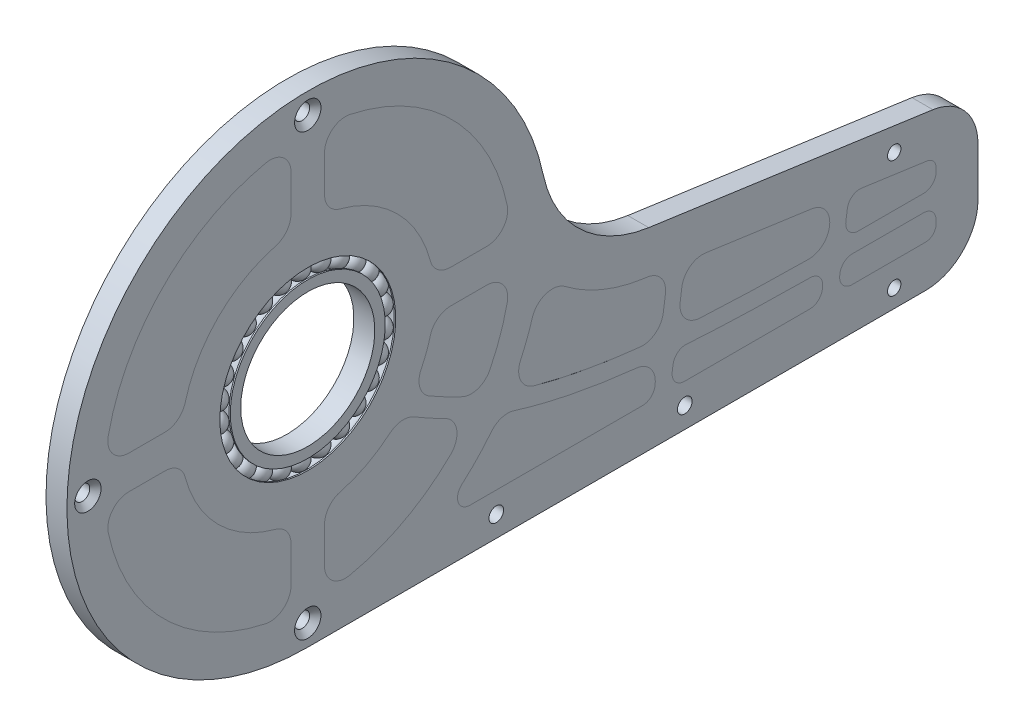
from build123d import *
from OCP.BRepFilletAPI import BRepFilletAPI_MakeFillet

# Parameters (mm, degrees)
SKETCH1_R                                    = 23.5
SKETCH1_R_2                                  = 1.75
BOSS_EXTRUDE1_DEPTH                          = 5
CUT_EXTRUDE1_DEPTH                           = 171.091886932
SKETCH11_R                                   = 1.6
CUT_EXTRUDE2_DEPTH                           = 171.091887063
FILLET1_R1                                   = 5
FILLET1_R2                                   = 3
BOSS_EXTRUDE2_DEPTH                          = 5
CIRPATTERN1_COUNT                            = 26
SKETCH7_R                                    = 1.75
BOSS_EXTRUDE3_DEPTH                          = 5
CSK_FOR_M3_COUNTERSUNK_FLAT_HEAD_SCR_2_COUNT = 2
CSK_FOR_M3_COUNTERSUNK_FLAT_HEAD_SCR_2_PITCH = 74.246212025
CSK_FOR_M3_COUNTERSUNK_FLAT_HEAD_SCR_3_COUNT = 2
CSK_FOR_M3_COUNTERSUNK_FLAT_HEAD_SCR_3_PITCH = 105


# Read off the part's stored shape, not the designer's step: Boss-Extrude2
with BuildPart() as part:
    # Sketch1 → Boss-Extrude1 (new body)
    with BuildSketch(Plane(origin=(0, 0, 0), x_dir=(0, 0, -1), z_dir=(1, 0, 0))):
        with BuildLine():
            Line((0, -57.5), (147.5, -57.5))
            ThreePointArc((147.5, -57.5), (156.338834765, -53.838834765), (160, -45))
            Line((160, -45), (160, -33.365178619))
            ThreePointArc((160, -33.365178619), (156.934208165, -25.164830072), (149.240685392, -20.986971383))
            Line((149.240685392, -20.986971383), (81.395536862, -11.446247371))
            ThreePointArc((81.395536862, -11.446247371), (65.121194516, -3.68658445), (56.233805186, 12.000381425))
            ThreePointArc((56.233805186, 12.000381425), (-44.700514158, 36.16785913), (0, -57.5))
        make_face()
        Circle(SKETCH1_R, mode=Mode.SUBTRACT)
        with Locations((0, 52.5)):
            Circle(SKETCH1_R_2, mode=Mode.SUBTRACT)
        with Locations((-52.5, 0)):
            Circle(SKETCH1_R_2, mode=Mode.SUBTRACT)
        with Locations((0, -52.5)):
            Circle(SKETCH1_R_2, mode=Mode.SUBTRACT)
        with Locations((45, -52.5)):
            Circle(SKETCH1_R_2, mode=Mode.SUBTRACT)
        with Locations((90, -52.5)):
            Circle(SKETCH1_R_2, mode=Mode.SUBTRACT)
    extrude(amount=BOSS_EXTRUDE1_DEPTH)

    # Sketch2 → Cut-Extrude1 (cut, through all)
    with BuildSketch(Plane(origin=(5, 0, 0), x_dir=(0, 0, -1), z_dir=(1, 0, 0))):
        with BuildLine():
            ThreePointArc((22.185246346, -20.586763819), (13.912908948, -26.878075909), (4, -30))
            Line((4, -30), (4, -48.5))
            ThreePointArc((4, -48.5), (23.432821368, -42.651528492), (38.790670249, -29.385947349))
            add(Edge.make_bspline(
                [(38.790670249, -29.385947349), (38.208277868, -29.138826897), (37.04735221, -28.634254689), (33.613250417, -27.069615417), (29.274833218, -24.860974129), (24.928400153, -22.320548454), (22.810244388, -20.988202917), (22.185246346, -20.586763819)],
                knots=[0.667204069, 0.667204069, 0.667204069, 0.667204069, 0.681111736, 0.695019404, 0.75, 0.787250705, 0.802875705, 0.802875705, 0.802875705, 0.802875705], degree=3))
        make_face()
        with BuildLine():
            add(Edge.make_bspline(
                [(41.120637072, -26.025818082), (40.546652129, -25.787609064), (39.402827933, -25.301001665), (35.833175383, -23.706675572), (31.540190896, -21.541218104), (27.246972835, -19.043482716), (25.325200598, -17.84518612), (24.721080246, -17.460475122)],
                knots=[0.660871723, 0.660871723, 0.660871723, 0.660871723, 0.675055768, 0.689239813, 0.75, 0.784024564, 0.799649564, 0.799649564, 0.799649564, 0.799649564], degree=3))
            ThreePointArc((41.120637072, -26.025818082), (46.143784119, -15.45966323), (48.5, -4))
            Line((48.5, -4), (30, -4))
            ThreePointArc((30, -4), (28.176146888, -11.050101654), (24.721080246, -17.460475122))
        make_face()
        with BuildLine():
            Line((30, 4), (48.201922205, 4))
            Line((48.201922205, 4), (48.5, 4))
            ThreePointArc((48.5, 4), (34.41111739, 34.41111739), (4, 48.5))
            Line((4, 48.5), (4, 30))
            ThreePointArc((4, 30), (21.400934559, 21.400934559), (30, 4))
        make_face()
        with BuildLine():
            ThreePointArc((45.879697443, -32.11001966), (38.546027668, -40.622699947), (29.6605799, -47.5))
            Line((29.6605799, -47.5), (82.519678579, -47.5))
            Line((82.519678579, -47.5), (83.638752831, -39.542138653))
            add(Edge.make_bspline(
                [(83.638752831, -39.542138653), (82.136627814, -39.407732053), (74.115556507, -38.620412405), (61.898724071, -36.757253444), (51.310285462, -33.943549975), (46.479451728, -32.317463696), (45.879697443, -32.11001966)],
                knots=[0.346672188, 0.346672188, 0.346672188, 0.346672188, 0.375, 0.5, 0.597665733, 0.6115734, 0.6115734, 0.6115734, 0.6115734], degree=3))
        make_face()
        with BuildLine():
            Line((87.5930026, -39.867473629), (86.519678579, -47.5))
            Line((86.519678579, -47.5), (122.480321421, -47.5))
            Line((122.480321421, -47.5), (123.379214774, -41.107869489))
            add(Edge.make_bspline(
                [(123.379214774, -41.107869489), (123.309909416, -41.107243691), (119.069012377, -41.068607323), (110.949562787, -40.952647021), (99.651727414, -40.60714539), (92.047864376, -40.193028013), (88.114578612, -39.906787388), (87.5930026, -39.867473629)],
                knots=[0.123962248, 0.123962248, 0.123962248, 0.123962248, 0.125, 0.1875, 0.25, 0.3125, 0.322106441, 0.322106441, 0.322106441, 0.322106441], degree=3))
        make_face()
        with BuildLine():
            add(Edge.make_bspline(
                [(84.196491813, -35.575994784), (82.647837316, -35.438625592), (74.684695363, -34.660281607), (63.048861545, -32.88222555), (53.085222246, -30.275299461), (48.711109914, -28.846362296), (48.118024667, -28.647088894)],
                knots=[0.345388461, 0.345388461, 0.345388461, 0.345388461, 0.375, 0.5, 0.589951496, 0.604135542, 0.604135542, 0.604135542, 0.604135542], degree=3))
            Line((84.196491813, -35.575994784), (86.077071858, -22.202981125))
            Line((86.077071858, -22.202981125), (80.002988548, -21.34881316))
            ThreePointArc((80.002988548, -21.34881316), (66.51040029, -16.904021152), (55.422178193, -8.023849723))
            ThreePointArc((55.422178193, -8.023849723), (52.787052395, -18.695643863), (48.118024667, -28.647088894))
        make_face()
        with BuildLine():
            Line((89.999504226, -22.754573177), (88.151196988, -35.898091313))
            add(Edge.make_bspline(
                [(123.94103929, -37.112672931), (123.696247868, -37.110561437), (119.287195408, -37.071300928), (111.033523944, -36.953360628), (99.8147399, -36.610105812), (92.380317535, -36.205001573), (88.580803362, -35.930099221), (88.151196988, -35.898091313)],
                knots=[0.121334068, 0.121334068, 0.121334068, 0.121334068, 0.125, 0.1875, 0.25, 0.3125, 0.320505317, 0.320505317, 0.320505317, 0.320505317], degree=3))
            Line((123.94103929, -37.112672931), (125.262801588, -27.713474368))
            Line((125.262801588, -27.713474368), (89.999504226, -22.754573177))
        make_face()
        with BuildLine():
            Line((127.414275447, -41.138422271), (126.519678579, -47.5))
            Line((126.519678579, -47.5), (147.5, -47.5))
            ThreePointArc((147.5, -47.5), (149.267766953, -46.767766953), (150, -45))
            Line((150, -45), (150, -41.182589309))
            add(Edge.make_bspline(
                [(150, -41.182589309), (148.812824417, -41.182589309), (146.423466184, -41.182589324), (141.76480628, -41.181393352), (136.080016811, -41.17541248), (130.968491752, -41.158687842), (128.116800073, -41.142792862), (127.414275447, -41.138422271)],
                knots=[0, 0, 0, 0, 0.015625, 0.03125, 0.0625, 0.09375, 0.104041802, 0.104041802, 0.104041802, 0.104041802], degree=3))
        make_face()
        with BuildLine():
            Line((129.223827903, -28.270493694), (127.976307043, -37.141753144))
            add(Edge.make_bspline(
                [(150, -37.182589309), (148.812993791, -37.182589309), (146.423722347, -37.182589295), (141.767251686, -37.181393752), (136.087757115, -37.175417046), (131.169092842, -37.159320148), (128.499860489, -37.144838913), (127.976307043, -37.141753144)],
                knots=[0, 0, 0, 0, 0.015625, 0.03125, 0.0625, 0.09375, 0.101416179, 0.101416179, 0.101416179, 0.101416179], degree=3))
            Line((150, -37.182589309), (150, -33.365178619))
            ThreePointArc((150, -33.365178619), (149.386841633, -31.725108909), (147.848137078, -30.889537172))
            Line((147.848137078, -30.889537172), (129.223827903, -28.270493694))
        make_face()
        with BuildLine():
            ThreePointArc((-4, -30), (-21.400934559, -21.400934559), (-30, -4))
            Line((-30, -4), (-48.5, -4))
            ThreePointArc((-48.5, -4), (-34.41111739, -34.41111739), (-4, -48.5))
            Line((-4, -48.5), (-4, -30))
        make_face()
        with BuildLine():
            ThreePointArc((-30, 4), (-21.400934559, 21.400934559), (-4, 30))
            Line((-4, 30), (-4, 48.5))
            ThreePointArc((-4, 48.5), (-34.41111739, 34.41111739), (-48.5, 4))
            Line((-48.5, 4), (-30, 4))
        make_face()
    extrude(amount=-CUT_EXTRUDE1_DEPTH, mode=Mode.SUBTRACT)

    # Sketch11 → Cut-Extrude2 (cut, through all)
    with BuildSketch(Plane(origin=(0, 0, 0), x_dir=(0, 0, -1), z_dir=(1, 0, 0))):
        with Locations((140, -25.182589309)):
            Circle(SKETCH11_R)
        with Locations(Location((140, -53.182589309, 0), (0, 0, 180))):
            Circle(SKETCH11_R)
    extrude(amount=CUT_EXTRUDE2_DEPTH, mode=Mode.SUBTRACT)

    # Fillet1: one fillet with a radius per group of edges: ONE call of the kernel's fillet builder (fillet() takes one radius for all edges)
    fillet1_edges_1 = [part.edges().sort_by_distance(p)[0] for p in [
        (2.5, 48.5, 4),
        (2.5, 4, 48.5),
        (2.5, 4, 30),
        (2.5, 30, 4),
        (2.5, 48.5, -4),
        (2.5, 30, -4),
        (2.5, 4, -48.5),
        (2.5, 4, -30),
        (2.5, -4, -30),
        (2.5, -4, -48.5),
        (2.5, -4, 48.5),
        (2.5, -4, 30),
        (2.5, -30, 4),
        (2.5, -29.385947349, -38.790670249),
        (2.5, -20.586763819, -22.185246346),
        (2.5, -48.5, -4),
        (2.5, -48.5, 4),
        (2.5, -32.11001966, -45.879697443),
        (2.5, -8.023849723, -55.422178193),
        (2.5, -22.202981125, -86.077071858),
        (2.5, -28.647088894, -48.118024667),
        (2.5, -35.575994784, -84.196491813),
        (2.5, -35.898091313, -88.151196988),
        (2.5, -27.713474368, -125.262801588),
        (2.5, -37.112672931, -123.94103929),
        (2.5, -22.754573177, -89.999504226),
        (2.5, -39.542138653, -83.638752831),
        (2.5, -30, -4),
        (2.5, -17.460475122, -24.721080246),
        (2.5, -26.025818082, -41.120637072),
    ]]
    fillet1_edges_2 = [part.edges().sort_by_distance(p)[0] for p in [
        (2.5, -47.5, -29.6605799),
        (2.5, -47.5, -82.519678579),
        (2.5, -39.867473629, -87.5930026),
        (2.5, -47.5, -86.519678579),
        (2.5, -41.107869489, -123.379214774),
        (2.5, -47.5, -122.480321421),
        (2.5, -41.138422271, -127.414275447),
        (2.5, -47.5, -126.519678579),
        (2.5, -28.270493694, -129.223827903),
        (2.5, -37.141753144, -127.976307043),
        (2.5, -37.182589309, -150),
        (2.5, -41.182589309, -150),
    ]]
    fillet1 = BRepFilletAPI_MakeFillet(part.part.solid().wrapped)
    for e in fillet1_edges_1:
        fillet1.Add(FILLET1_R1, e.wrapped)
    for e in fillet1_edges_2:
        fillet1.Add(FILLET1_R2, e.wrapped)
    add(Compound.cast(fillet1.Shape()), mode=Mode.REPLACE)

    # Sketch4 → Revolve3 (revolve)
    with BuildSketch(Plane.XY, mode=Mode.PRIVATE) as revolve3_sk:
        with BuildLine():
            ThreePointArc((0.334936491, 18.5), (2.5, 17.25), (4.665063509, 18.5))
            Line((4.665063509, 18.5), (5, 18.5))
            Line((5, 18.5), (5, 16))
            Line((5, 16), (0, 16))
            Line((0, 16), (0, 18.5))
            Line((0, 18.5), (0.334936491, 18.5))
        make_face()
        with BuildLine():
            ThreePointArc((4.665063509, 21), (2.5, 22.25), (0.334936491, 21))
            Line((0.334936491, 21), (0, 21))
            Line((0, 21), (0, 23.5))
            Line((0, 23.5), (5, 23.5))
            Line((5, 23.5), (5, 21))
            Line((5, 21), (4.665063509, 21))
        make_face()
    revolve(revolve3_sk.sketch.rotate(Axis((0, 0, 0), (1, 0, 0)), 90), axis=Axis((0, 0, 0), (1, 0, 0)))


with BuildPart() as body_2:
    # Boss-Extrude2 outline → Boss-Extrude2 (new body)
    with BuildSketch(Plane(origin=(0, 0, 0), x_dir=(0, 0, -1), z_dir=(1, 0, 0))):
        with BuildLine():
            ThreePointArc((127.000301711, -44.082235506), (127.706861488, -46.468083651), (129.971071448, -47.5))
            Line((129.971071448, -47.5), (147.5, -47.5))
            ThreePointArc((147.5, -47.5), (149.267766953, -46.767766953), (150, -45))
            Line((150, -45), (150, -44.182500207))
            ThreePointArc((150, -44.182500207), (149.121415194, -42.061274718), (147.000268283, -41.182500219))
            add(Edge.make_bspline(
                [(147.000268283, -41.182500219), (146.812686203, -41.182483444), (145.443341439, -41.182337706), (141.76480628, -41.181393352), (136.255555018, -41.175597161), (132.030232477, -41.162146761), (130.034095757, -41.152710267)],
                knots=[0.013149231, 0.013149231, 0.013149231, 0.013149231, 0.015625, 0.03125, 0.0625, 0.091337611, 0.091337611, 0.091337611, 0.091337611], degree=3))
            ThreePointArc((130.034095757, -41.152710267), (128.057187471, -41.883821212), (127.049144044, -43.734912251))
            Line((127.049144044, -43.734912251), (127.000301711, -44.082235506))
        make_face()
        with BuildLine():
            Line((89.971071448, -47.5), (119.872678552, -47.5))
            ThreePointArc((119.872678552, -47.5), (121.840762204, -46.76420996), (122.843448289, -44.917764494))
            Line((122.843448289, -44.917764494), (122.903627951, -44.489820231))
            ThreePointArc((122.903627951, -44.489820231), (122.208769003, -42.117514849), (119.968652158, -41.072269279))
            add(Edge.make_bspline(
                [(119.968652158, -41.072269279), (116.930598371, -41.036018723), (109.976696211, -40.922895571), (100.092777534, -40.620633242), (93.419117385, -40.267091683), (90.372954412, -40.064496339)],
                knots=[0.14114579, 0.14114579, 0.14114579, 0.14114579, 0.1875, 0.25, 0.305180288, 0.305180288, 0.305180288, 0.305180288], degree=3))
            ThreePointArc((90.372954412, -40.064496339), (88.282040284, -40.729582629), (87.203099383, -42.64011873))
            Line((87.203099383, -42.64011873), (87.000301711, -44.082235506))
            ThreePointArc((87.000301711, -44.082235506), (87.706861488, -46.468083651), (89.971071448, -47.5))
        make_face()
        with BuildLine():
            Line((38.73951471, -47.5), (79.91203571, -47.5))
            ThreePointArc((79.91203571, -47.5), (81.880119362, -46.76420996), (82.882805447, -44.917764494))
            Line((82.882805447, -44.917764494), (82.913898967, -44.696655021))
            ThreePointArc((82.913898967, -44.696655021), (81.911175874, -40.932991828), (78.51236968, -39.030695665))
            add(Edge.make_bspline(
                [(78.51236968, -39.030695665), (72.309256976, -38.344498563), (62.27249356, -36.793159127), (52.985980437, -34.385427724), (49.222984389, -33.209816183)],
                knots=[0.379394701, 0.379394701, 0.379394701, 0.379394701, 0.5, 0.585926939, 0.585926939, 0.585926939, 0.585926939], degree=3))
            ThreePointArc((49.222984389, -33.209816183), (46.264295939, -33.202595877), (43.819526871, -34.869027299))
            ThreePointArc((43.819526871, -34.869027299), (40.46268709, -38.713963287), (36.769708878, -42.237288136))
            ThreePointArc((36.769708878, -42.237288136), (35.929876336, -45.551633112), (38.73951471, -47.5))
        make_face()
        with BuildLine():
            Line((150, -34.182500163), (150, -33.365178619))
            ThreePointArc((150, -33.365178619), (149.386841633, -31.725108909), (147.848137078, -30.889537172))
            Line((147.848137078, -30.889537172), (132.19459764, -28.688258188))
            ThreePointArc((132.19459764, -28.688258188), (129.971585827, -29.262972392), (128.806063409, -31.24126343))
            Line((128.806063409, -31.24126343), (128.454541654, -33.74097369))
            ThreePointArc((128.454541654, -33.74097369), (129.157125744, -36.122238598), (131.413176817, -37.158713643))
            add(Edge.make_bspline(
                [(131.413176817, -37.158713643), (132.964881549, -37.164990119), (136.738536803, -37.176101881), (141.767251686, -37.181393752), (145.443755956, -37.18233769), (146.812493402, -37.182483398), (146.999731573, -37.182500151)],
                knots=[0.013153288, 0.013153288, 0.013153288, 0.013153288, 0.035451406, 0.066701406, 0.082326406, 0.084798118, 0.084798118, 0.084798118, 0.084798118], degree=3))
            ThreePointArc((146.999731573, -37.182500151), (149.121225438, -36.303915408), (150, -34.182500163))
        make_face()
        with BuildLine():
            Line((124.552654082, -32.763412189), (124.566527431, -32.664757263))
            ThreePointArc((124.566527431, -32.664757263), (123.608670425, -28.959737573), (120.311518694, -27.017200211))
            Line((120.311518694, -27.017200211), (94.95078712, -23.450847334))
            ThreePointArc((94.95078712, -23.450847334), (91.245767431, -24.40870434), (89.303230069, -27.705856071))
            Line((89.303230069, -27.705856071), (88.900856811, -30.567177017))
            ThreePointArc((88.900856811, -30.567177017), (89.985118561, -34.433016992), (93.562888485, -36.255077535))
            add(Edge.make_bspline(
                [(93.562888485, -36.255077535), (95.645334652, -36.375749647), (101.312204101, -36.655922881), (109.9215952, -36.91933957), (116.679734901, -37.031346079), (119.539466767, -37.066754802)],
                knots=[0.143583711, 0.143583711, 0.143583711, 0.143583711, 0.18105653, 0.24355653, 0.287472819, 0.287472819, 0.287472819, 0.287472819], degree=3))
            ThreePointArc((119.539466767, -37.066754802), (122.858086538, -35.86105489), (124.552654082, -32.763412189))
        make_face()
        with BuildLine():
            Line((81.125788964, -21.506706968), (80.002988548, -21.34881316))
            ThreePointArc((80.002988548, -21.34881316), (70.218668397, -18.674155024), (61.421707918, -13.624382426))
            ThreePointArc((61.421707918, -13.624382426), (56.854417413, -12.85589305), (53.615661085, -16.166659718))
            ThreePointArc((53.615661085, -16.166659718), (52.345035582, -19.899679643), (50.814856037, -23.534026557))
            ThreePointArc((50.814856037, -23.534026557), (50.813374255, -27.733328861), (54.013210489, -30.452738745))
            add(Edge.make_bspline(
                [(54.013210489, -30.452738745), (56.511617504, -31.147001548), (64.503556907, -33.097971644), (73.121226203, -34.421311833), (79.372600536, -35.101053847)],
                knots=[0.376625329, 0.376625329, 0.376625329, 0.376625329, 0.43449557, 0.557870241, 0.557870241, 0.557870241, 0.557870241], degree=3))
            ThreePointArc((79.372600536, -35.101053847), (82.98415693, -34.076051454), (84.864371713, -30.826626603))
            Line((84.864371713, -30.826626603), (85.380797701, -27.154264019))
            ThreePointArc((85.380797701, -27.154264019), (84.422940695, -23.44924433), (81.125788964, -21.506706968))
        make_face()
        with BuildLine():
            ThreePointArc((-47.61971687, -10.0305815), (-34.41111739, -34.41111739), (-10.0305815, -47.61971687))
            ThreePointArc((-10.0305815, -47.61971687), (-5.849833933, -46.609920301), (-4, -42.727079363))
            Line((-4, -42.727079363), (-4, -34.097726009))
            ThreePointArc((-4, -34.097726009), (-5.038928508, -31.046511064), (-7.723965056, -29.263293797))
            ThreePointArc((-7.723965056, -29.263293797), (-21.400934559, -21.400934559), (-29.263293797, -7.723965056))
            ThreePointArc((-29.263293797, -7.723965056), (-31.046511064, -5.038928508), (-34.097726009, -4))
            Line((-34.097726009, -4), (-42.727079363, -4))
            ThreePointArc((-42.727079363, -4), (-46.609920301, -5.849833933), (-47.61971687, -10.0305815))
        make_face()
        with BuildLine():
            ThreePointArc((10.0305815, -47.61971687), (23.006224156, -42.883139461), (34.128327556, -34.691602129))
            ThreePointArc((34.128327556, -34.691602129), (35.559721465, -30.341494752), (32.848768838, -26.650551976))
            add(Edge.make_bspline(
                [(32.848768838, -26.650551976), (31.413241176, -25.936452988), (28.92150774, -24.62767543), (26.453145204, -23.207625264), (25.400791824, -22.579226637)],
                knots=[0.715007628, 0.715007628, 0.715007628, 0.715007628, 0.75, 0.776154556, 0.776154556, 0.776154556, 0.776154556], degree=3))
            ThreePointArc((25.400791824, -22.579226637), (22.422590157, -21.889337831), (19.599438982, -23.062133284))
            ThreePointArc((19.599438982, -23.062133284), (14.009129165, -26.828050619), (7.723965056, -29.263293797))
            ThreePointArc((7.723965056, -29.263293797), (5.038928508, -31.046511064), (4, -34.097726009))
            Line((4, -34.097726009), (4, -42.727079363))
            ThreePointArc((4, -42.727079363), (5.849833933, -46.609920301), (10.0305815, -47.61971687))
        make_face()
        with BuildLine():
            ThreePointArc((43.470458548, -21.876225306), (45.928584059, -16.087733411), (47.61971687, -10.0305815))
            ThreePointArc((47.61971687, -10.0305815), (46.609920301, -5.849833933), (42.727079363, -4))
            Line((42.727079363, -4), (34.097726009, -4))
            ThreePointArc((34.097726009, -4), (31.046511064, -5.038928508), (29.263293797, -7.723965056))
            ThreePointArc((29.263293797, -7.723965056), (28.319488967, -10.67738473), (27.078470008, -13.51874484))
            ThreePointArc((27.078470008, -13.51874484), (26.765470141, -17.197622518), (29.062468052, -20.088281696))
            add(Edge.make_bspline(
                [(29.062468052, -20.088281696), (29.543171425, -20.364263669), (32.128533422, -21.8221752), (34.737633759, -23.15259074), (36.885206954, -24.157389595)],
                knots=[0.696055038, 0.696055038, 0.696055038, 0.696055038, 0.708398801, 0.762343763, 0.762343763, 0.762343763, 0.762343763], degree=3))
            ThreePointArc((36.885206954, -24.157389595), (40.640744743, -24.353139054), (43.470458548, -21.876225306))
        make_face()
        with BuildLine():
            ThreePointArc((47.61971687, 10.0305815), (34.41111739, 34.41111739), (10.0305815, 47.61971687))
            ThreePointArc((10.0305815, 47.61971687), (5.849833933, 46.609920301), (4, 42.727079363))
            Line((4, 42.727079363), (4, 34.097726009))
            ThreePointArc((4, 34.097726009), (5.038928508, 31.046511064), (7.723965056, 29.263293797))
            ThreePointArc((7.723965056, 29.263293797), (21.400934559, 21.400934559), (29.263293797, 7.723965056))
            ThreePointArc((29.263293797, 7.723965056), (31.046511064, 5.038928508), (34.097726009, 4))
            Line((34.097726009, 4), (42.727079363, 4))
            ThreePointArc((42.727079363, 4), (46.609920301, 5.849833933), (47.61971687, 10.0305815))
        make_face()
        with BuildLine():
            ThreePointArc((-10.0305815, 47.61971687), (-34.41111739, 34.41111739), (-47.61971687, 10.0305815))
            ThreePointArc((-47.61971687, 10.0305815), (-46.609920301, 5.849833933), (-42.727079363, 4))
            Line((-42.727079363, 4), (-34.097726009, 4))
            ThreePointArc((-34.097726009, 4), (-31.046511064, 5.038928508), (-29.263293797, 7.723965056))
            ThreePointArc((-29.263293797, 7.723965056), (-21.400934559, 21.400934559), (-7.723965056, 29.263293797))
            ThreePointArc((-7.723965056, 29.263293797), (-5.038928508, 31.046511064), (-4, 34.097726009))
            Line((-4, 34.097726009), (-4, 42.727079363))
            ThreePointArc((-4, 42.727079363), (-5.849833933, 46.609920301), (-10.0305815, 47.61971687))
        make_face()
    extrude(amount=BOSS_EXTRUDE2_DEPTH)


with BuildPart() as revolve3_piece_1:
    # of the separate pieces the step leaves, piece 1, a body of its own (revolve3_pieces)
    add(part.part.solids().sort_by_distance((0, -29.263293797, -7.723965056))[0])

    # Sketch7 → Boss-Extrude3 (add, through all)
    with BuildSketch(Plane(origin=(5, 0, 0), x_dir=(0, 0, -1), z_dir=(1, 0, 0))):
        with Locations((0, -52.5)):
            Circle(SKETCH7_R)
        with Locations((-52.5, 0)):
            Circle(SKETCH7_R)
        with Locations((0, 52.5)):
            Circle(SKETCH7_R)
    extrude(amount=-BOSS_EXTRUDE3_DEPTH)

    # Sketch9 → CSK for M3 Countersunk Flat Head Screw1 (revolve, cut)
    with BuildSketch(Plane(origin=(5, 52.5, 0), x_dir=(0, 0, -1), z_dir=(0, 1, 0))):
        Polygon((0, 0), (0, 11.081549114), (1.8, 10), (1.8, 1.35), (3.15, 0), align=None)
    csk_for_m3_countersunk_flat_head_screw1 = revolve(axis=Axis((11.35, 52.5, 0), (-1, 0, 0)), mode=Mode.SUBTRACT)

    # CSK for M3 Countersunk Flat Head Scr 2: CSK for M3 Countersunk Flat Head Screw1 ×2
    with Locations(*[Vector(0, -0.7071067811865137, 0.7071067811865814) * (i * CSK_FOR_M3_COUNTERSUNK_FLAT_HEAD_SCR_2_PITCH) for i in range(1, CSK_FOR_M3_COUNTERSUNK_FLAT_HEAD_SCR_2_COUNT)]):
        add(csk_for_m3_countersunk_flat_head_screw1, mode=Mode.SUBTRACT)

    # CSK for M3 Countersunk Flat Head Scr 3: CSK for M3 Countersunk Flat Head Screw1 ×2
    with Locations(*[(0, -i * CSK_FOR_M3_COUNTERSUNK_FLAT_HEAD_SCR_3_PITCH, 0) for i in range(1, CSK_FOR_M3_COUNTERSUNK_FLAT_HEAD_SCR_3_COUNT)]):
        add(csk_for_m3_countersunk_flat_head_screw1, mode=Mode.SUBTRACT)


with BuildPart() as revolve3_piece_2:
    # of the separate pieces the step leaves, piece 2, a body of its own (revolve3_pieces)
    add(part.part.solids().sort_by_distance((0.334936491, 0, 18.5))[0])


with BuildPart() as body_4:
    # Sketch5 → Revolve9 (revolve)
    with BuildSketch(Plane.XY):
        with BuildLine():
            Line((4.85, 19.75), (0.15, 19.75))
            ThreePointArc((0.15, 19.75), (2.5, 17.4), (4.85, 19.75))
        make_face()
    revolve(axis=Axis((2.5, 19.75, 0), (1, 0, 0)))


with BuildPart() as cirpattern1_1:
    # CirPattern1: pattern copy
    add(body_4.part.rotate(Axis((0, 0, 0), (1, 0, 0)), 1 * 360 / CIRPATTERN1_COUNT))


with BuildPart() as cirpattern1_2:
    # CirPattern1: pattern copy
    add(body_4.part.rotate(Axis((0, 0, 0), (1, 0, 0)), 2 * 360 / CIRPATTERN1_COUNT))


with BuildPart() as cirpattern1_3:
    # CirPattern1: pattern copy
    add(body_4.part.rotate(Axis((0, 0, 0), (1, 0, 0)), 3 * 360 / CIRPATTERN1_COUNT))


with BuildPart() as cirpattern1_4:
    # CirPattern1: pattern copy
    add(body_4.part.rotate(Axis((0, 0, 0), (1, 0, 0)), 4 * 360 / CIRPATTERN1_COUNT))


with BuildPart() as cirpattern1_5:
    # CirPattern1: pattern copy
    add(body_4.part.rotate(Axis((0, 0, 0), (1, 0, 0)), 5 * 360 / CIRPATTERN1_COUNT))


with BuildPart() as cirpattern1_6:
    # CirPattern1: pattern copy
    add(body_4.part.rotate(Axis((0, 0, 0), (1, 0, 0)), 6 * 360 / CIRPATTERN1_COUNT))


with BuildPart() as cirpattern1_7:
    # CirPattern1: pattern copy
    add(body_4.part.rotate(Axis((0, 0, 0), (1, 0, 0)), 7 * 360 / CIRPATTERN1_COUNT))


with BuildPart() as cirpattern1_8:
    # CirPattern1: pattern copy
    add(body_4.part.rotate(Axis((0, 0, 0), (1, 0, 0)), 8 * 360 / CIRPATTERN1_COUNT))


with BuildPart() as cirpattern1_9:
    # CirPattern1: pattern copy
    add(body_4.part.rotate(Axis((0, 0, 0), (1, 0, 0)), 9 * 360 / CIRPATTERN1_COUNT))


with BuildPart() as cirpattern1_10:
    # CirPattern1: pattern copy
    add(body_4.part.rotate(Axis((0, 0, 0), (1, 0, 0)), 10 * 360 / CIRPATTERN1_COUNT))


with BuildPart() as cirpattern1_11:
    # CirPattern1: pattern copy
    add(body_4.part.rotate(Axis((0, 0, 0), (1, 0, 0)), 11 * 360 / CIRPATTERN1_COUNT))


with BuildPart() as cirpattern1_12:
    # CirPattern1: pattern copy
    add(body_4.part.rotate(Axis((0, 0, 0), (1, 0, 0)), 12 * 360 / CIRPATTERN1_COUNT))


with BuildPart() as cirpattern1_13:
    # CirPattern1: pattern copy
    add(body_4.part.rotate(Axis((0, 0, 0), (1, 0, 0)), 13 * 360 / CIRPATTERN1_COUNT))


with BuildPart() as cirpattern1_14:
    # CirPattern1: pattern copy
    add(body_4.part.rotate(Axis((0, 0, 0), (1, 0, 0)), 14 * 360 / CIRPATTERN1_COUNT))


with BuildPart() as cirpattern1_15:
    # CirPattern1: pattern copy
    add(body_4.part.rotate(Axis((0, 0, 0), (1, 0, 0)), 15 * 360 / CIRPATTERN1_COUNT))


with BuildPart() as cirpattern1_16:
    # CirPattern1: pattern copy
    add(body_4.part.rotate(Axis((0, 0, 0), (1, 0, 0)), 16 * 360 / CIRPATTERN1_COUNT))


with BuildPart() as cirpattern1_17:
    # CirPattern1: pattern copy
    add(body_4.part.rotate(Axis((0, 0, 0), (1, 0, 0)), 17 * 360 / CIRPATTERN1_COUNT))


with BuildPart() as cirpattern1_18:
    # CirPattern1: pattern copy
    add(body_4.part.rotate(Axis((0, 0, 0), (1, 0, 0)), 18 * 360 / CIRPATTERN1_COUNT))


with BuildPart() as cirpattern1_19:
    # CirPattern1: pattern copy
    add(body_4.part.rotate(Axis((0, 0, 0), (1, 0, 0)), 19 * 360 / CIRPATTERN1_COUNT))


with BuildPart() as cirpattern1_20:
    # CirPattern1: pattern copy
    add(body_4.part.rotate(Axis((0, 0, 0), (1, 0, 0)), 20 * 360 / CIRPATTERN1_COUNT))


with BuildPart() as cirpattern1_21:
    # CirPattern1: pattern copy
    add(body_4.part.rotate(Axis((0, 0, 0), (1, 0, 0)), 21 * 360 / CIRPATTERN1_COUNT))


with BuildPart() as cirpattern1_22:
    # CirPattern1: pattern copy
    add(body_4.part.rotate(Axis((0, 0, 0), (1, 0, 0)), 22 * 360 / CIRPATTERN1_COUNT))


with BuildPart() as cirpattern1_23:
    # CirPattern1: pattern copy
    add(body_4.part.rotate(Axis((0, 0, 0), (1, 0, 0)), 23 * 360 / CIRPATTERN1_COUNT))


with BuildPart() as cirpattern1_24:
    # CirPattern1: pattern copy
    add(body_4.part.rotate(Axis((0, 0, 0), (1, 0, 0)), 24 * 360 / CIRPATTERN1_COUNT))


with BuildPart() as cirpattern1_25:
    # CirPattern1: pattern copy
    add(body_4.part.rotate(Axis((0, 0, 0), (1, 0, 0)), 25 * 360 / CIRPATTERN1_COUNT))


solid = Compound([body_2.part, revolve3_piece_1.part, revolve3_piece_2.part, body_4.part, cirpattern1_1.part, cirpattern1_2.part, cirpattern1_3.part, cirpattern1_4.part, cirpattern1_5.part, cirpattern1_6.part, cirpattern1_7.part, cirpattern1_8.part, cirpattern1_9.part, cirpattern1_10.part, cirpattern1_11.part, cirpattern1_12.part, cirpattern1_13.part, cirpattern1_14.part, cirpattern1_15.part, cirpattern1_16.part, cirpattern1_17.part, cirpattern1_18.part, cirpattern1_19.part, cirpattern1_20.part, cirpattern1_21.part, cirpattern1_22.part, cirpattern1_23.part, cirpattern1_24.part, cirpattern1_25.part])
